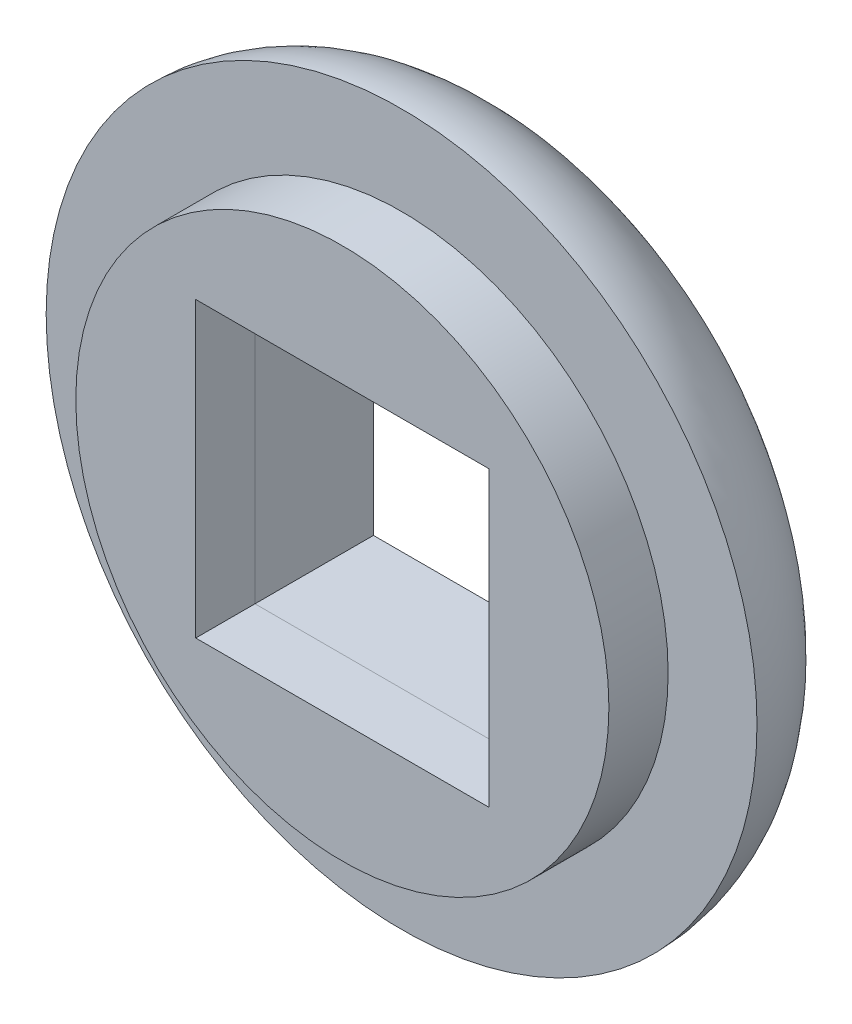
from build123d import *

# Parameters (mm, degrees)
SKETCH1_R           = 4.5
SKETCH1_W           = 4.949747468
SKETCH1_H           = 4.949747468
BOSS_EXTRUDE1_DEPTH = 1
SKETCH2_R           = 6
SKETCH2_W           = 4.949747468
SKETCH2_H           = 4.949747468
BOSS_EXTRUDE2_DEPTH = 2
FILLET1_R           = 2


with BuildPart() as part:
    # Sketch1 → Boss-Extrude1 (new body)
    with BuildSketch(Plane.XY):
        Circle(SKETCH1_R)
        Rectangle(SKETCH1_W, SKETCH1_H, mode=Mode.SUBTRACT)
    extrude(amount=BOSS_EXTRUDE1_DEPTH)


with BuildPart() as body_2:
    # Sketch2 → Boss-Extrude2 (new body)
    with BuildSketch(Plane(origin=(0, 0, 0), x_dir=(-1, 0, 0), z_dir=(0, 0, -1))):
        Circle(SKETCH2_R)
        Rectangle(SKETCH2_W, SKETCH2_H, mode=Mode.SUBTRACT)
    extrude(amount=BOSS_EXTRUDE2_DEPTH)

    # Fillet1
    fillet1_edges = [body_2.edges().sort_by_distance(p)[0] for p in [
        (6, 0, -2),
    ]]
    fillet(fillet1_edges, radius=FILLET1_R - 0.0001)  # a hair under: the kernel refuses the full size


solid = Compound([part.part, body_2.part])
